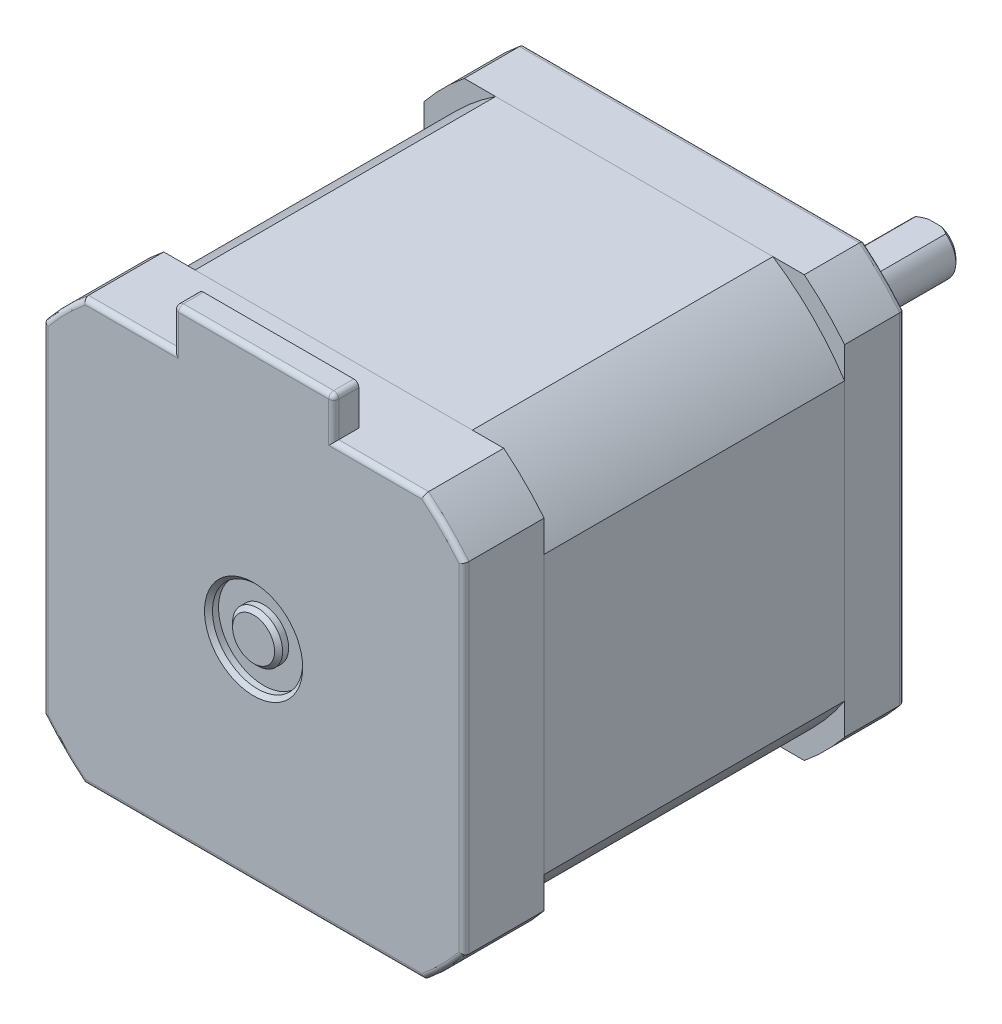
from build123d import *

# Parameters (mm, degrees)
BOSS_EXTRU_1_DEPTH           = 6
BOSS_EXTRU_2_DEPTH           = 30
BOSS_EXTRU_3_DEPTH           = 8
ESQUISSE4_W                  = 16
ESQUISSE4_H                  = 2.5
BOSS_EXTRU_4_DEPTH           = 4
ESQUISSE5_W                  = 2
ESQUISSE5_H                  = 6.5
ESQUISSE5_W_2                = 24
ESQUISSE5_H_2                = 2.5
CONG_1_R                     = 0.5
CONG_2_R                     = 0.5
CHANFREIN1_SIZE              = 0.4
CHANFREIN2_SIZE              = 0.4
ENL_V_MAT_EXTRU_1_DEPTH      = 55.790510246
ENL_V_MAT_EXTRU_1_DEPTH_BACK = 55.790510246
ESQUISSE6_W                  = 15
ESQUISSE6_H                  = 0.5
ESQUISSE7_R                  = 4.5
ESQUISSE7_R_2                = 2.5
ENL_V_MAT_EXTRU_2_DEPTH      = 1
CHANFREIN3_SIZE              = 0.4
TROU_TARAUD_M31_AT_2_COUNT   = 2
TROU_TARAUD_M31_AT_2_PITCH   = 31
TROU_TARAUD_M31_AT_3_COUNT   = 2
TROU_TARAUD_M31_AT_3_PITCH   = 43.840620434
TROU_TARAUD_M31_AT_4_COUNT   = 2
TROU_TARAUD_M31_AT_4_PITCH   = 31


with BuildPart() as part:
    # Esquisse1 → Boss.-Extru.1 (new body)
    with BuildSketch(Plane.XY):
        with BuildLine():
            Line((21, 16.970562748), (21, -16.970562748))
            ThreePointArc((21, -16.970562748), (19.091883092, -19.091883092), (16.970562748, -21))
            Line((16.970562748, -21), (-16.970562748, -21))
            ThreePointArc((-16.970562748, -21), (-19.091883092, -19.091883092), (-21, -16.970562748))
            Line((-21, -16.970562748), (-21, 16.970562748))
            ThreePointArc((-21, 16.970562748), (-19.091883092, 19.091883092), (-16.970562748, 21))
            Line((-16.970562748, 21), (16.970562748, 21))
            ThreePointArc((16.970562748, 21), (19.091883092, 19.091883092), (21, 16.970562748))
        make_face()
    extrude(amount=BOSS_EXTRU_1_DEPTH)

    # Congé2
    cong_2_edges = [part.edges().sort_by_distance(p)[0] for p in [
        (-19.091883092, 19.091883092, 0),
        (-21, 0, 0),
        (-19.091883092, -19.091883092, 0),
        (0, -21, 0),
        (19.091883092, -19.091883092, 0),
        (21, 0, 0),
        (0, 21, 0),
        (19.091883092, 19.091883092, 0),
    ]]
    fillet(cong_2_edges, radius=CONG_2_R)

    # Esquisse9 → Trou taraudé M31 (revolve, cut)
    with BuildSketch(Plane(origin=(15.5, -15.5, 0), x_dir=(0, 1, 0), z_dir=(1, 0, 0))):
        Polygon((0, 0), (0, 5.751075774), (1.25, 5), (1.25, 0), align=None)
    trou_taraud_m31 = revolve(axis=Axis((15.5, -15.5, -6.35), (0, 0, 1)), mode=Mode.SUBTRACT)

    # Trou taraudé M31 at 2: Trou taraudé M31 ×2
    with Locations(*[(0, i * TROU_TARAUD_M31_AT_2_PITCH, 0) for i in range(1, TROU_TARAUD_M31_AT_2_COUNT)]):
        add(trou_taraud_m31, mode=Mode.SUBTRACT)

    # Trou taraudé M31 at 3: Trou taraudé M31 ×2
    with Locations(*[Vector(-0.7071067811865476, 0.7071067811865476, 0) * (i * TROU_TARAUD_M31_AT_3_PITCH) for i in range(1, TROU_TARAUD_M31_AT_3_COUNT)]):
        add(trou_taraud_m31, mode=Mode.SUBTRACT)

    # Trou taraudé M31 at 4: Trou taraudé M31 ×2
    with Locations(*[(-i * TROU_TARAUD_M31_AT_4_PITCH, 0, 0) for i in range(1, TROU_TARAUD_M31_AT_4_COUNT)]):
        add(trou_taraud_m31, mode=Mode.SUBTRACT)


with BuildPart() as body_2:
    # Esquisse2 → Boss.-Extru.2 (new body)
    with BuildSketch(Plane.XY.offset(6)):
        with BuildLine():
            Line((-13.839165437, 21), (13.839165437, 21))
            ThreePointArc((13.839165437, 21), (17.783735547, 17.783735547), (21, 13.839165437))
            Line((21, 13.839165437), (21, -13.839165437))
            ThreePointArc((21, -13.839165437), (17.783735547, -17.783735547), (13.839165437, -21))
            Line((13.839165437, -21), (-13.839165437, -21))
            ThreePointArc((-13.839165437, -21), (-17.783735547, -17.783735547), (-21, -13.839165437))
            Line((-21, -13.839165437), (-21, 13.839165437))
            ThreePointArc((-21, 13.839165437), (-17.783735547, 17.783735547), (-13.839165437, 21))
        make_face()
    extrude(amount=BOSS_EXTRU_2_DEPTH)


with BuildPart() as body_3:
    # Esquisse3 → Boss.-Extru.3 (new body)
    with BuildSketch(Plane.XY.offset(36)):
        with BuildLine():
            Line((-16.970562748, -21), (16.970562748, -21))
            ThreePointArc((16.970562748, -21), (19.091883092, -19.091883092), (21, -16.970562748))
            Line((21, -16.970562748), (21, 16.970562748))
            ThreePointArc((21, 16.970562748), (19.091883092, 19.091883092), (16.970562748, 21))
            Line((16.970562748, 21), (-16.970562748, 21))
            ThreePointArc((-16.970562748, 21), (-19.091883092, 19.091883092), (-21, 16.970562748))
            Line((-21, 16.970562748), (-21, -16.970562748))
            ThreePointArc((-21, -16.970562748), (-19.091883092, -19.091883092), (-16.970562748, -21))
        make_face()
    extrude(amount=BOSS_EXTRU_3_DEPTH)

    # Esquisse4 → Boss.-Extru.4 (add)
    with BuildSketch(Plane(origin=(0, 21, 0), x_dir=(1, 0, 0), z_dir=(0, 1, 0))):
        with Locations((0, -42.75)):
            Rectangle(ESQUISSE4_W, ESQUISSE4_H)
    extrude(amount=BOSS_EXTRU_4_DEPTH)

    # Congé1
    cong_1_edges = [body_3.edges().sort_by_distance(p)[0] for p in [
        (-21, 0, 44),
        (-19.091883092, 19.091883092, 44),
        (-12.485281374, 21, 44),
        (-8, 23, 44),
        (0, 25, 44),
        (8, 23, 44),
        (12.485281374, 21, 44),
        (19.091883092, 19.091883092, 44),
        (21, 0, 44),
        (19.091883092, -19.091883092, 44),
        (0, -21, 44),
        (-19.091883092, -19.091883092, 44),
        (-8, 25, 42.75),
        (8, 25, 42.75),
    ]]
    fillet(cong_1_edges, radius=CONG_1_R)

    # Esquisse7 → Enlèv. mat.-Extru.2 (cut)
    with BuildSketch(Plane.XY.offset(44)):
        Circle(ESQUISSE7_R)
        Circle(ESQUISSE7_R_2, mode=Mode.SUBTRACT)
    extrude(amount=-ENL_V_MAT_EXTRU_2_DEPTH, mode=Mode.SUBTRACT)

    # Chanfrein3
    chanfrein3_edges = [body_3.edges().sort_by_distance(p)[0] for p in [
        (-4.5, 0, 44),
        (-2.5, 0, 44),
    ]]
    chamfer(chanfrein3_edges, length=CHANFREIN3_SIZE)


with BuildPart() as body_4:
    # Esquisse5 → Révolution1 (revolve)
    with BuildSketch(Plane(origin=(0, 0, 0), x_dir=(0, 0, -1), z_dir=(1, 0, 0))):
        with Locations((1, 7.75)):
            Rectangle(ESQUISSE5_W, ESQUISSE5_H)
        with Locations((12, 1.25)):
            Rectangle(ESQUISSE5_W_2, ESQUISSE5_H_2)
    revolve(axis=Axis((0, 0, 0), (0, 0, 1)))

    # Chanfrein1
    chanfrein1_edges = [body_4.edges().sort_by_distance(p)[0] for p in [
        (0, -2.5, -24),
    ]]
    chamfer(chanfrein1_edges, length=CHANFREIN1_SIZE)

    # Chanfrein2
    chanfrein2_edges = [body_4.edges().sort_by_distance(p)[0] for p in [
        (0, -4.5, -2),
        (0, -11, -2),
    ]]
    chamfer(chanfrein2_edges, length=CHANFREIN2_SIZE)

    # Esquisse6 → Enlèv. mat.-Extru.1 (cut, two sides: drawn at the far end of the back side and taken through both)
    with BuildSketch(Plane(origin=(0, 0, 0), x_dir=(0, 0, -1), z_dir=(1, 0, 0)).offset(-ENL_V_MAT_EXTRU_1_DEPTH_BACK)):
        with Locations((16.5, 2.25)):
            Rectangle(ESQUISSE6_W, ESQUISSE6_H)
    extrude(amount=ENL_V_MAT_EXTRU_1_DEPTH + ENL_V_MAT_EXTRU_1_DEPTH_BACK, mode=Mode.SUBTRACT)


solid = Compound([part.part, body_2.part, body_3.part, body_4.part])
